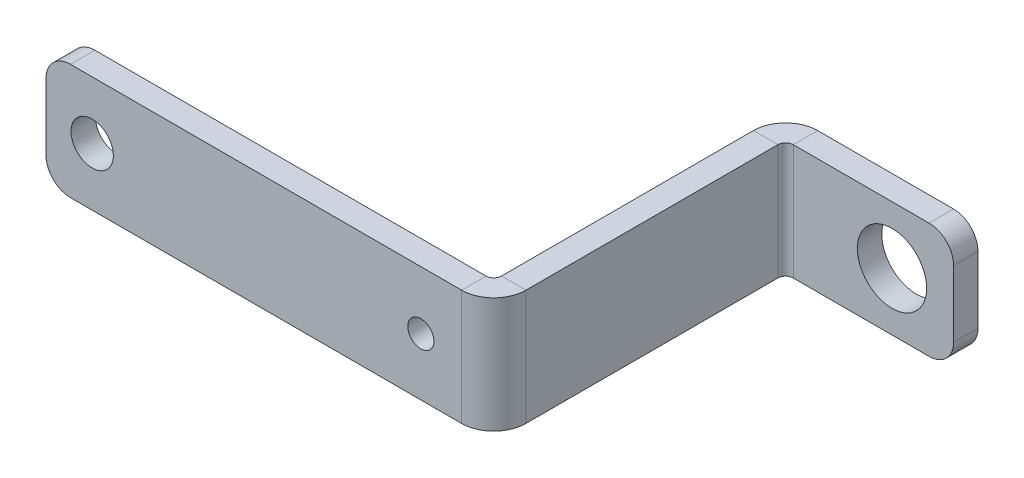
from build123d import *

# Parameters (mm, degrees)
BASE_FLANGE1_DEPTH   = 3.175
EDGE_FLANGE1_DEPTH   = 15
EDGE_FLANGE2_DEPTH   = 15
M5_CLEARANCE_HOLE1_D = 5.5
M8_CLEARANCE_HOLE1_D = 9
FILLET1_R            = 3.175
M3_CLEARANCE_HOLE1_D = 3.4


# Sheet-metal steps are written as plain solids
with BuildPart() as part:
    # Sketch2 → Base-Flange1 (new body)
    with BuildSketch(Plane.XY):
        Polygon((79.909284585, 306.128054742), (73.909284585, 306.128054742), (73.909284585, 321.128054742), (79.909284585, 321.128054742), (127.909284585, 321.128054742), (127.909284585, 306.128054742), align=None)
    extrude(amount=BASE_FLANGE1_DEPTH)

    # Edge-Flange1 section (across the edge) → Edge-Flange1 (add)
    with BuildSketch(Plane(origin=(128.909284585, 321.128054742, 0), x_dir=(-1, 0, 0), z_dir=(0, -1, 0))):
        with BuildLine():
            Line((-3.175, 1), (-3.175, 33.738))
            Line((-3.175, 33.738), (0, 33.738))
            Line((0, 33.738), (0, 1))
            ThreePointArc((0, 1), (0.292893219, 0.292893219), (1, 0))
            Line((1, 0), (1, -3.175))
            ThreePointArc((1, -3.175), (-1.952170811, -1.952170811), (-3.175, 1))
        make_face()
    extrude(amount=EDGE_FLANGE1_DEPTH)

    # Edge-Flange2 section (across the edge) → Edge-Flange2 (add)
    with BuildSketch(Plane(origin=(132.084284585, 306.128054742, -34.738), x_dir=(0, 0, 1), z_dir=(0, 1, 0))):
        with BuildLine():
            Line((-3.175, 1), (-3.175, 21.825))
            Line((-3.175, 21.825), (0, 21.825))
            Line((0, 21.825), (0, 1))
            ThreePointArc((0, 1), (0.292893219, 0.292893219), (1, 0))
            Line((1, 0), (1, -3.175))
            ThreePointArc((1, -3.175), (-1.952170811, -1.952170811), (-3.175, 1))
        make_face()
    extrude(amount=EDGE_FLANGE2_DEPTH)

    # M5 Clearance Hole1 (through all)
    with Locations(Plane.XY.offset(3.175)):
        with Locations((79.909284585, 313.628054742)):
            Hole(M5_CLEARANCE_HOLE1_D / 2)

    # M8 Clearance Hole1 (through all)
    with Locations(Plane.XY.offset(-34.738)):
        with Locations((145.909284585, 313.628054742)):
            Hole(M8_CLEARANCE_HOLE1_D / 2)

    # Fillet1
    fillet1_edges = [part.edges().sort_by_distance(p)[0] for p in [
        (73.909284585, 306.128054742, 1.5875),
        (73.909284585, 321.128054742, 1.5875),
        (153.909284585, 306.128054742, -36.3255),
        (153.909284585, 321.128054742, -36.3255),
    ]]
    fillet(fillet1_edges, radius=FILLET1_R)

    # M3 Clearance Hole1 (through all)
    with Locations(Plane.XY.offset(3.175)):
        with Locations((122.609284585, 313.578054742)):
            Hole(M3_CLEARANCE_HOLE1_D / 2)


solid = part.part
